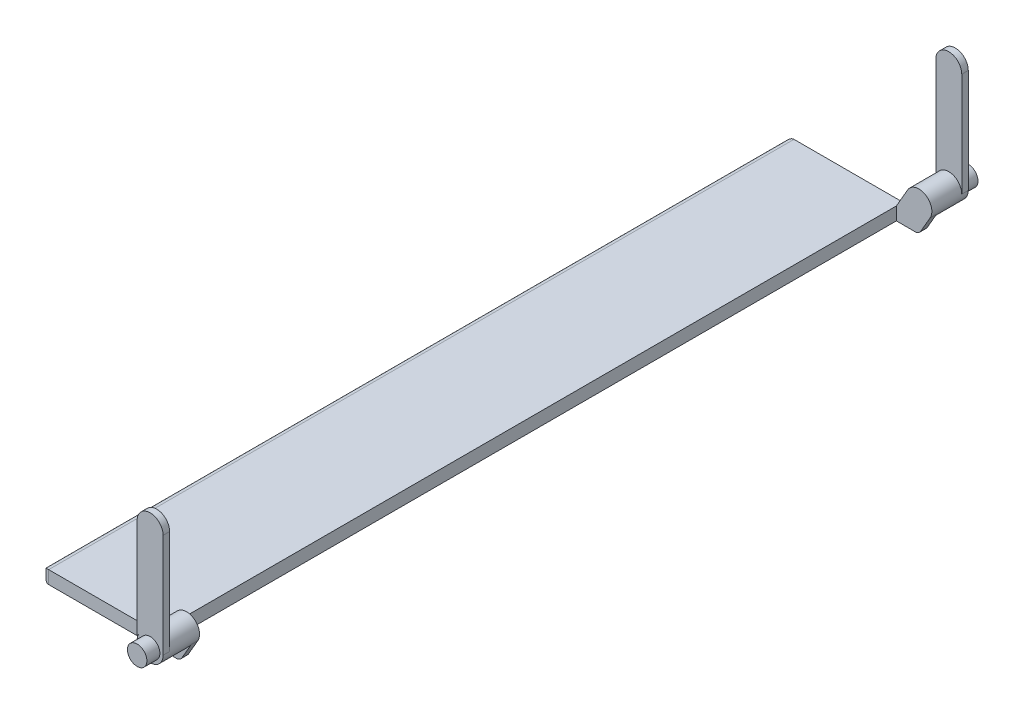
from build123d import *
from build123d.topology import SkipClean

# Parameters (mm, degrees)
SKETCH1_R               = 3.175
SKETCH1_R_2             = 2.38125
BOSS_EXTRUDE1_DEPTH     = 91.1098
CUT_EXTRUDE1_DEPTH      = 98.351934288
CUT_EXTRUDE1_DEPTH_BACK = 98.351934288
FILLET1_R               = 1.5875
BOSS_EXTRUDE2_START     = 7.3152
SKETCH3_R               = 3.175
BOSS_EXTRUDE2_DEPTH     = 7.3152
SKETCH4_R               = 2.38125
BOSS_EXTRUDE3_DEPTH     = 3.175
BOSS_EXTRUDE4_START     = -1.5875
BOSS_EXTRUDE4_DEPTH     = 1.5875


with BuildPart() as part:
    # Sketch1 → Boss-Extrude1 (new, symmetric)
    # profile 1 of 3: a face of its own
    with BuildSketch(Plane.XY):
        with BuildLine():
            Line((-33.7058, -3.175), (-33.7058, -6.35))
            Line((-33.7058, -6.35), (0, -6.35))
            Line((0, -6.35), (2.749630657, -1.5875))
            ThreePointArc((2.749630657, -1.5875), (-1.5875, -2.749630657), (-2.749630657, 1.5875))
            Line((-2.749630657, 1.5875), (-5.499261314, -3.175))
            Line((-5.499261314, -3.175), (-33.7058, -3.175))
        make_face()
    # profile 2 of 3: a face of its own
    with BuildSketch(Plane.XY):
        Circle(SKETCH1_R)
        Circle(SKETCH1_R_2, mode=Mode.SUBTRACT)
    # profile 3 of 3: a face of its own
    with BuildSketch(Plane.XY):
        Circle(SKETCH1_R_2)
    extrude(amount=BOSS_EXTRUDE1_DEPTH, both=True)

    # Sketch2 → Cut-Extrude1 (cut, two sides: drawn at the far end of the back side and taken through both)
    with BuildSketch(Plane(origin=(0, 0, 0), x_dir=(1, 0, 0), z_dir=(0, 1, 0)).offset(-CUT_EXTRUDE1_DEPTH_BACK)):
        Polygon((-5.499261314, 89.5223), (-5.499261314, -89.5223), (3.175, -89.5223), (3.175, 0), (3.175, 89.5223), align=None)
    extrude(amount=CUT_EXTRUDE1_DEPTH + CUT_EXTRUDE1_DEPTH_BACK, mode=Mode.SUBTRACT)

    # Fillet1
    fillet1_edges = [part.edges().sort_by_distance(p)[0] for p in [
        (0, -6.35, 90.31605),
        (-33.7058, -6.35, 0),
        (-33.7058, -3.175, 0),
        (-33.7058, -4.7625, 91.1098),
        (0, -6.35, -90.31605),
        (-33.7058, -4.7625, -91.1098),
    ]]
    fillet(fillet1_edges, radius=FILLET1_R - 0.0001)  # a hair under: the kernel refuses the full size

    # Sketch3 → Boss-Extrude2 (add)
    with BuildSketch(Plane.XY.offset(91.1098).offset(BOSS_EXTRUDE2_START)):
        with Locations(Location((0, 0, 0), (0, 0, 150))):
            Circle(SKETCH3_R)
    boss_extrude2 = extrude(amount=-BOSS_EXTRUDE2_DEPTH)

    # Sketch4 → Boss-Extrude3 (add)
    with BuildSketch(Plane.XY.offset(98.425)):
        Circle(SKETCH4_R)
    boss_extrude3 = extrude(amount=BOSS_EXTRUDE3_DEPTH)

    # Mirror1: Boss-Extrude2, Boss-Extrude3 across plane
    with SkipClean():  # the faces are left unmerged after this step: merging them gives an invalid solid
        add(boss_extrude2.mirror(Plane.XY))
        add(boss_extrude3.mirror(Plane.XY))

    # Sketch6 → Boss-Extrude4 (add)
    with SkipClean():  # the faces are left unmerged after this step: merging them gives an invalid solid
        with BuildSketch(Plane(origin=(0, 0, -98.425), x_dir=(-1, 0, 0), z_dir=(0, 0, -1)).offset(BOSS_EXTRUDE4_START)):
            with BuildLine():
                Line((2.749630657, 1.5875), (3.175, 0.850738686))
                Line((3.175, 0.850738686), (3.175, 25.4))
                ThreePointArc((3.175, 25.4), (0, 28.575), (-3.175, 25.4))
                Line((-3.175, 25.4), (-3.175, 0))
                ThreePointArc((-3.175, 0), (-0.821750468, 3.066814498), (2.749630657, 1.5875))
            make_face()
        boss_extrude4 = extrude(amount=BOSS_EXTRUDE4_DEPTH)

    # Mirror2: Boss-Extrude4 across plane
    with SkipClean():  # the faces are left unmerged after this step: merging them gives an invalid solid
        add(boss_extrude4.mirror(Plane.XY))


solid = part.part
